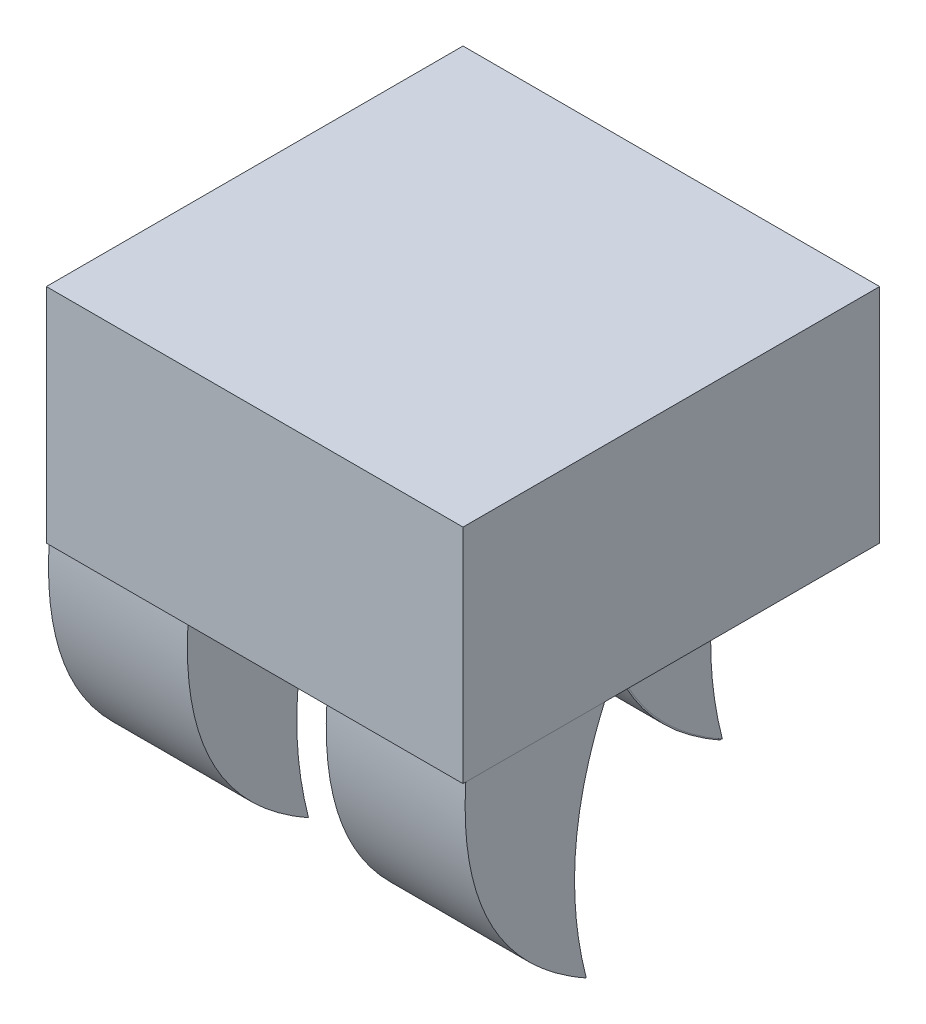
from build123d import *

# Parameters (mm, degrees)
SKETCH_1_W               = 15
SKETCH_1_H               = 15
EXTRUDE_1_DEPTH          = 4
EXTRUDE_2_DEPTH          = 2.5
PATTERN_START            = -7.500040123
PATTERN_SKETCH_2_DEPTH   = 5
PATTERN_START_2          = 2.499959877
PATTERN_SKETCH_2_2_DEPTH = 5
PATTERN_START_3          = -2.500040123
PATTERN_SKETCH_2_3_DEPTH = 5


with BuildPart() as part:
    # 스케치1 → 보스-돌출1 (new, symmetric)
    with BuildSketch(Plane(origin=(0, 0, 0), x_dir=(1, 0, 0), z_dir=(0, 1, 0))):
        Rectangle(SKETCH_1_W, SKETCH_1_H)
    extrude(amount=EXTRUDE_1_DEPTH, both=True)

    # 스케치3 → 보스-돌출2 (add, symmetric)
    with BuildSketch(Plane(origin=(0, 0, 0), x_dir=(0, 0, -1), z_dir=(1, 0, 0))):
        with BuildLine():
            Line((2.5, -4), (7.5, -4))
            add(Edge.make_bspline(
                [(6.837946582, -12.278081575), (5.73941202, -8.009656666), (7.5, -4)],
                knots=[0, 0, 0, 1, 1, 1], degree=2))
            add(Edge.make_bspline(
                [(2.5, -4), (2.152812134, -9.664313578), (6.837946582, -12.278081575)],
                knots=[0, 0, 0, 1, 1, 1], degree=2))
        make_face()
    extrude(amount=EXTRUDE_2_DEPTH, both=True)

    # 스케치 패턴2: read off the stored shape, not the designer's step
    # 스케치 패턴2 outline → 스케치 패턴2 (add)
    with BuildSketch(Plane.YZ.offset(PATTERN_START)):
        with BuildLine():
            Line((-4, 2.400000403), (-4, 7.400000403))
            add(Edge.make_bspline(
                [(-4, 7.400000403), (-9.664313578, 7.747188269), (-12.278081575, 3.062053822)],
                knots=[0, 0, 0, 1, 1, 1], degree=2))
            add(Edge.make_bspline(
                [(-12.278081575, 3.062053822), (-8.009656666, 4.160588383), (-4, 2.400000403)],
                knots=[0, 0, 0, 1, 1, 1], degree=2))
        make_face()
    extrude(amount=PATTERN_SKETCH_2_DEPTH)

    # Pattern Sketch 2 2 outline → Pattern Sketch 2 2 (add)
    with BuildSketch(Plane.YZ.offset(PATTERN_START_2)):
        with BuildLine():
            Line((-4, 2.400000403), (-4, 7.400000403))
            add(Edge.make_bspline(
                [(-4, 7.400000403), (-9.664313578, 7.747188269), (-12.278081575, 3.062053822)],
                knots=[0, 0, 0, 1, 1, 1], degree=2))
            add(Edge.make_bspline(
                [(-12.278081575, 3.062053822), (-8.009656666, 4.160588383), (-4, 2.400000403)],
                knots=[0, 0, 0, 1, 1, 1], degree=2))
        make_face()
    extrude(amount=PATTERN_SKETCH_2_2_DEPTH)

    # Pattern Sketch 2 3 outline → Pattern Sketch 2 3 (add)
    with BuildSketch(Plane.YZ.offset(PATTERN_START_3)):
        with BuildLine():
            add(Edge.make_bspline(
                [(-4, -2.439999597), (-9.664313578, -2.092811731), (-12.278081575, -6.777946178)],
                knots=[0, 0, 0, 1, 1, 1], degree=2))
            add(Edge.make_bspline(
                [(-12.278081575, -6.777946178), (-8.009656666, -5.679411617), (-4, -7.439999597)],
                knots=[0, 0, 0, 1, 1, 1], degree=2))
            Line((-4, -7.439999597), (-4, -2.439999597))
        make_face()
    extrude(amount=PATTERN_SKETCH_2_3_DEPTH)


solid = part.part
